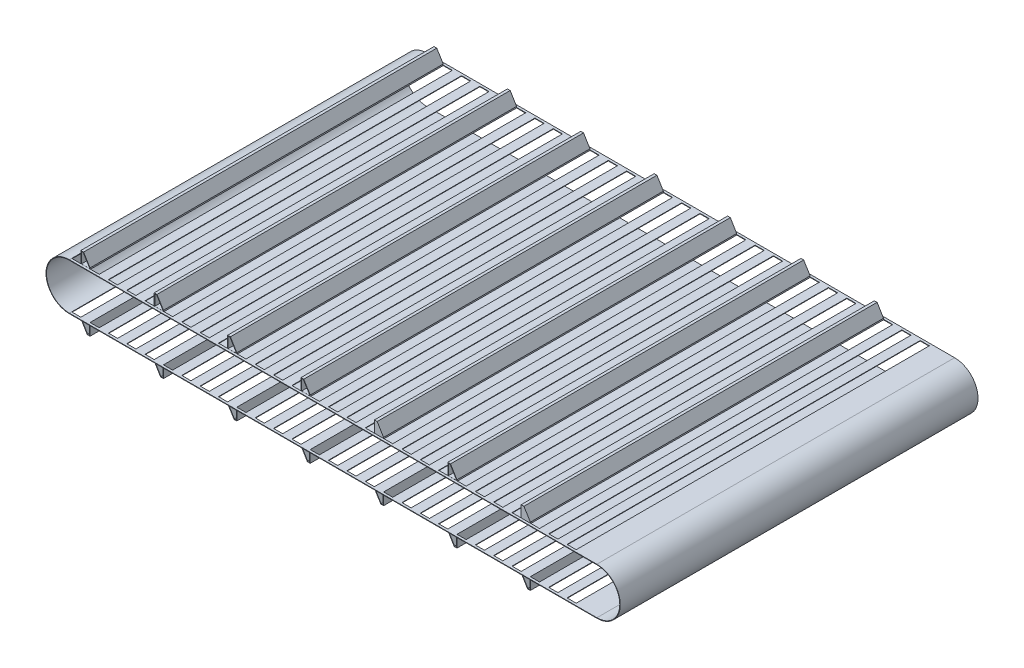
from build123d import *

# Parameters (mm, degrees)
EXTRUDE_THIN1_DEPTH     = 780
CUT_EXTRUDE1_DEPTH      = 11574.91019364
CUT_EXTRUDE1_DEPTH_BACK = 11574.91019364
SKETCH2_W               = 20
SKETCH2_H               = 770
SKETCH3_W               = 20
SKETCH3_H               = 770
BOSS_EXTRUDE1_DEPTH     = 25
CUT_EXTRUDE2_DEPTH      = 11574.37436405
SHELL2_START            = 6.2
SHELL2_DEPTH            = 767.6
SHELL2_START_2          = 5
SHELL2_2_DEPTH          = 770
SHELL2_3_DEPTH          = 1.2
SHELL2_START_3          = 773.8
SHELL2_4_DEPTH          = 1.2
SKETCH6_W               = 20
SKETCH6_H               = 770
BOSS_EXTRUDE2_DEPTH     = 25
CUT_EXTRUDE3_DEPTH      = 11574.37436405
CUT_EXTRUDE3_DEPTH_BACK = 11574.37436405
SHELL3_START            = 5
SHELL3_DEPTH            = 770


# Read off the part's stored shape, not the designer's step: Shell2, Shell3
with BuildPart() as part:
    # Sketch1 → Extrude-Thin1 (new body)
    with BuildSketch(Plane.XY):
        with BuildLine():
            Line((-10346.146538018, -51), (-11496.146538018, -51))
            ThreePointArc((-11496.146538018, -51), (-11547.146538017, 0), (-11496.146538018, 51))
            Line((-11496.146538018, 51), (-10346.146538018, 51))
            ThreePointArc((-10346.146538018, 51), (-10295.146538018, 0), (-10346.146538018, -51))
        make_face()
        with BuildLine():
            Line((-10346.146538018, -50), (-11496.146538018, -50))
            ThreePointArc((-11496.146538018, -50), (-11546.146538017, 0), (-11496.146538018, 50))
            Line((-11496.146538018, 50), (-10346.146538018, 50))
            ThreePointArc((-10346.146538018, 50), (-10296.146538018, 0), (-10346.146538018, -50))
        make_face(mode=Mode.SUBTRACT)
    extrude(amount=EXTRUDE_THIN1_DEPTH)

    # Sketch2 → Cut-Extrude1 (cut, two sides: drawn at the far end of the back side and taken through both)
    with BuildSketch(Plane(origin=(0, 51, 0), x_dir=(1, 0, 0), z_dir=(0, 1, 0)).offset(-CUT_EXTRUDE1_DEPTH_BACK)):
        with Locations((-11486.146538018, -390)):
            Rectangle(SKETCH2_W, SKETCH2_H)
        with Locations((-11446.146538018, -390)):
            Rectangle(SKETCH2_W, SKETCH2_H)
        with Locations((-11406.146538018, -390)):
            Rectangle(SKETCH2_W, SKETCH2_H)
        with Locations((-11366.146538018, -390)):
            Rectangle(SKETCH2_W, SKETCH2_H)
        with Locations((-11326.146538018, -390)):
            Rectangle(SKETCH2_W, SKETCH2_H)
        with Locations((-11286.146538018, -390)):
            Rectangle(SKETCH2_W, SKETCH2_H)
        with Locations((-11246.146538018, -390)):
            Rectangle(SKETCH2_W, SKETCH2_H)
        with Locations((-11206.146538018, -390)):
            Rectangle(SKETCH2_W, SKETCH2_H)
        with Locations((-11166.146538018, -390)):
            Rectangle(SKETCH2_W, SKETCH2_H)
        with Locations((-11126.146538018, -390)):
            Rectangle(SKETCH2_W, SKETCH2_H)
        with Locations((-11086.146538018, -390)):
            Rectangle(SKETCH2_W, SKETCH2_H)
        with Locations((-11046.146538018, -390)):
            Rectangle(SKETCH2_W, SKETCH2_H)
        with Locations((-11006.146538018, -390)):
            Rectangle(SKETCH2_W, SKETCH2_H)
        with Locations((-10966.146538018, -390)):
            Rectangle(SKETCH2_W, SKETCH2_H)
        with Locations((-10926.146538018, -390)):
            Rectangle(SKETCH2_W, SKETCH2_H)
        with Locations((-10886.146538018, -390)):
            Rectangle(SKETCH2_W, SKETCH2_H)
        with Locations((-10846.146538018, -390)):
            Rectangle(SKETCH2_W, SKETCH2_H)
        with Locations((-10806.146538018, -390)):
            Rectangle(SKETCH2_W, SKETCH2_H)
        with Locations((-10766.146538018, -390)):
            Rectangle(SKETCH2_W, SKETCH2_H)
        with Locations((-10726.146538018, -390)):
            Rectangle(SKETCH2_W, SKETCH2_H)
        with Locations((-10686.146538018, -390)):
            Rectangle(SKETCH2_W, SKETCH2_H)
        with Locations((-10646.146538018, -390)):
            Rectangle(SKETCH2_W, SKETCH2_H)
        with Locations((-10606.146538018, -390)):
            Rectangle(SKETCH2_W, SKETCH2_H)
        with Locations((-10566.146538018, -390)):
            Rectangle(SKETCH2_W, SKETCH2_H)
        with Locations((-10526.146538018, -390)):
            Rectangle(SKETCH2_W, SKETCH2_H)
        with Locations((-10486.146538018, -390)):
            Rectangle(SKETCH2_W, SKETCH2_H)
        with Locations((-10446.146538018, -390)):
            Rectangle(SKETCH2_W, SKETCH2_H)
        with Locations((-10406.146538018, -390)):
            Rectangle(SKETCH2_W, SKETCH2_H)
    extrude(amount=CUT_EXTRUDE1_DEPTH + CUT_EXTRUDE1_DEPTH_BACK, mode=Mode.SUBTRACT)

    # Sketch3 → Boss-Extrude1 (add)
    with BuildSketch(Plane(origin=(0, 51, 0), x_dir=(1, 0, 0), z_dir=(0, 1, 0))):
        with Locations((-11306.146538018, -390)):
            Rectangle(SKETCH3_W, SKETCH3_H)
        with Locations((-11466.146538018, -390)):
            Rectangle(SKETCH3_W, SKETCH3_H)
        with Locations((-11146.146538018, -390)):
            Rectangle(SKETCH3_W, SKETCH3_H)
        with Locations((-10986.146538018, -390)):
            Rectangle(SKETCH3_W, SKETCH3_H)
        with Locations((-10826.146538018, -390)):
            Rectangle(SKETCH3_W, SKETCH3_H)
        with Locations((-10666.146538018, -390)):
            Rectangle(SKETCH3_W, SKETCH3_H)
        with Locations((-10506.146538018, -390)):
            Rectangle(SKETCH3_W, SKETCH3_H)
    extrude(amount=BOSS_EXTRUDE1_DEPTH)

    # Sketch4 → Cut-Extrude2 (cut, through all)
    with BuildSketch(Plane.XY.offset(775)):
        Polygon((-11470.146538018, 76), (-11456.146538018, 53), (-11456.146538018, 76), align=None)
        Polygon((-11310.146538018, 76), (-11296.146538018, 53), (-11296.146538018, 76), align=None)
        Polygon((-11150.146538018, 76), (-11136.146538018, 53), (-11136.146538018, 76), align=None)
        Polygon((-10990.146538018, 76), (-10976.146538018, 53), (-10976.146538018, 76), align=None)
        Polygon((-10830.146538018, 76), (-10816.146538018, 53), (-10816.146538018, 76), align=None)
        Polygon((-10670.146538018, 76), (-10656.146538018, 53), (-10656.146538018, 76), align=None)
        Polygon((-10510.146538018, 76), (-10496.146538018, 53), (-10496.146538018, 76), align=None)
    extrude(amount=-CUT_EXTRUDE2_DEPTH, mode=Mode.SUBTRACT)

    # Shell2 outline → Shell2 (cut)
    with BuildSketch(Plane.XY.offset(SHELL2_START)):
        Polygon((-10497.346538018, 52.663500797), (-10510.820928837, 74.8), (-10514.946538018, 74.8), (-10514.946538018, 51.2), (-10497.346538018, 51.2), align=None)
        Polygon((-10670.820928837, 74.8), (-10674.946538018, 74.8), (-10674.946538018, 51.2), (-10657.346538018, 51.2), (-10657.346538018, 52.663500797), align=None)
        Polygon((-10830.820928837, 74.8), (-10834.946538018, 74.8), (-10834.946538018, 51.2), (-10817.346538018, 51.2), (-10817.346538018, 52.663500797), align=None)
        Polygon((-10990.820928837, 74.8), (-10994.946538018, 74.8), (-10994.946538018, 51.2), (-10977.346538018, 51.2), (-10977.346538018, 52.663500797), align=None)
        Polygon((-11150.820928837, 74.8), (-11154.946538018, 74.8), (-11154.946538018, 51.2), (-11137.346538018, 51.2), (-11137.346538018, 52.663500797), align=None)
        Polygon((-11310.820928837, 74.8), (-11314.946538018, 74.8), (-11314.946538018, 51.2), (-11297.346538018, 51.2), (-11297.346538018, 52.663500797), align=None)
        Polygon((-11457.346538018, 52.663500797), (-11470.820928837, 74.8), (-11474.946538018, 74.8), (-11474.946538018, 51.2), (-11457.346538018, 51.2), align=None)
    extrude(amount=SHELL2_DEPTH, mode=Mode.SUBTRACT)

    # Shell2 2 outline → Shell2 2 (cut)
    with BuildSketch(Plane.XY.offset(SHELL2_START_2)):
        Polygon((-10670.820928837, 74.8), (-10674.946538018, 74.8), (-10674.946538018, 51.2), (-10657.346538018, 51.2), (-10657.346538018, 52.663500797), align=None)
        Polygon((-10990.820928837, 74.8), (-10994.946538018, 74.8), (-10994.946538018, 51.2), (-10977.346538018, 51.2), (-10977.346538018, 52.663500797), align=None)
        Polygon((-11150.820928837, 74.8), (-11154.946538018, 74.8), (-11154.946538018, 51.2), (-11137.346538018, 51.2), (-11137.346538018, 52.663500797), align=None)
        Polygon((-11457.346538018, 52.663500797), (-11470.820928837, 74.8), (-11474.946538018, 74.8), (-11474.946538018, 51.2), (-11457.346538018, 51.2), align=None)
    extrude(amount=SHELL2_2_DEPTH, mode=Mode.SUBTRACT)

    # Shell2 3 outline → Shell2 3 (cut)
    with BuildSketch(Plane.XY.offset(SHELL2_START_2)):
        Polygon((-10497.346538018, 52.663500797), (-10510.820928837, 74.8), (-10514.946538018, 74.8), (-10514.946538018, 51.2), (-10497.346538018, 51.2), align=None)
        Polygon((-10830.820928837, 74.8), (-10834.946538018, 74.8), (-10834.946538018, 51.2), (-10817.346538018, 51.2), (-10817.346538018, 52.663500797), align=None)
    extrude(amount=SHELL2_3_DEPTH, mode=Mode.SUBTRACT)

    # Shell2 4 outline → Shell2 4 (cut)
    with BuildSketch(Plane.XY.offset(SHELL2_START_3)):
        Polygon((-11310.820928837, 74.8), (-11314.946538018, 74.8), (-11314.946538018, 51.2), (-11297.346538018, 51.2), (-11297.346538018, 52.663500797), align=None)
    extrude(amount=SHELL2_4_DEPTH, mode=Mode.SUBTRACT)

    # Sketch6 → Boss-Extrude2 (add)
    with BuildSketch(Plane.XZ.offset(51)):
        with Locations((-11466.146538018, 390)):
            Rectangle(SKETCH6_W, SKETCH6_H)
        with Locations((-11306.146538018, 390)):
            Rectangle(SKETCH6_W, SKETCH6_H)
        with Locations((-11146.146538018, 390)):
            Rectangle(SKETCH6_W, SKETCH6_H)
        with Locations((-10986.146538018, 390)):
            Rectangle(SKETCH6_W, SKETCH6_H)
        with Locations((-10826.146538018, 390)):
            Rectangle(SKETCH6_W, SKETCH6_H)
        with Locations((-10666.146538018, 390)):
            Rectangle(SKETCH6_W, SKETCH6_H)
        with Locations((-10506.146538018, 390)):
            Rectangle(SKETCH6_W, SKETCH6_H)
    extrude(amount=BOSS_EXTRUDE2_DEPTH)

    # Sketch7 → Cut-Extrude3 (cut, two sides: drawn at the far end of the back side and taken through both)
    with BuildSketch(Plane.XY.offset(775).offset(-CUT_EXTRUDE3_DEPTH_BACK)):
        Polygon((-11476.146538018, -53), (-11462.146538018, -76), (-11476.146538018, -76), align=None)
        Polygon((-11316.146538018, -53), (-11302.146538018, -76), (-11316.146538018, -76), align=None)
        Polygon((-11156.146538018, -53), (-11142.146538018, -76), (-11156.146538018, -76), align=None)
        Polygon((-10996.146538018, -53), (-10982.146538018, -76), (-10996.146538018, -76), align=None)
        Polygon((-10836.146538018, -53), (-10822.146538018, -76), (-10836.146538018, -76), align=None)
        Polygon((-10676.146538018, -53), (-10662.146538018, -76), (-10676.146538018, -76), align=None)
        Polygon((-10516.146538018, -53), (-10502.146538018, -76), (-10516.146538018, -76), align=None)
    extrude(amount=CUT_EXTRUDE3_DEPTH + CUT_EXTRUDE3_DEPTH_BACK, mode=Mode.SUBTRACT)

    # Shell3 outline → Shell3 (cut)
    with BuildSketch(Plane.XY.offset(SHELL3_START)):
        Polygon((-10514.946538018, -51.2), (-10514.946538018, -52.663500797), (-10501.472147199, -74.8), (-10497.346538018, -74.8), (-10497.346538018, -51.2), align=None)
        Polygon((-10674.946538018, -51.2), (-10674.946538018, -52.663500797), (-10661.472147199, -74.8), (-10657.346538018, -74.8), (-10657.346538018, -51.2), align=None)
        Polygon((-10834.946538018, -51.2), (-10834.946538018, -52.663500797), (-10821.472147199, -74.8), (-10817.346538018, -74.8), (-10817.346538018, -51.2), align=None)
        Polygon((-10994.946538018, -51.2), (-10994.946538018, -52.663500797), (-10981.472147199, -74.8), (-10977.346538018, -74.8), (-10977.346538018, -51.2), align=None)
        Polygon((-11154.946538018, -51.2), (-11154.946538018, -52.663500797), (-11141.472147199, -74.8), (-11137.346538018, -74.8), (-11137.346538018, -51.2), align=None)
        Polygon((-11297.346538018, -74.8), (-11297.346538018, -51.2), (-11314.946538018, -51.2), (-11314.946538018, -52.663500797), (-11301.472147199, -74.8), align=None)
        Polygon((-11457.346538018, -74.8), (-11457.346538018, -51.2), (-11474.946538018, -51.2), (-11474.946538018, -52.663500797), (-11461.472147199, -74.8), align=None)
    extrude(amount=SHELL3_DEPTH, mode=Mode.SUBTRACT)


solid = part.part
